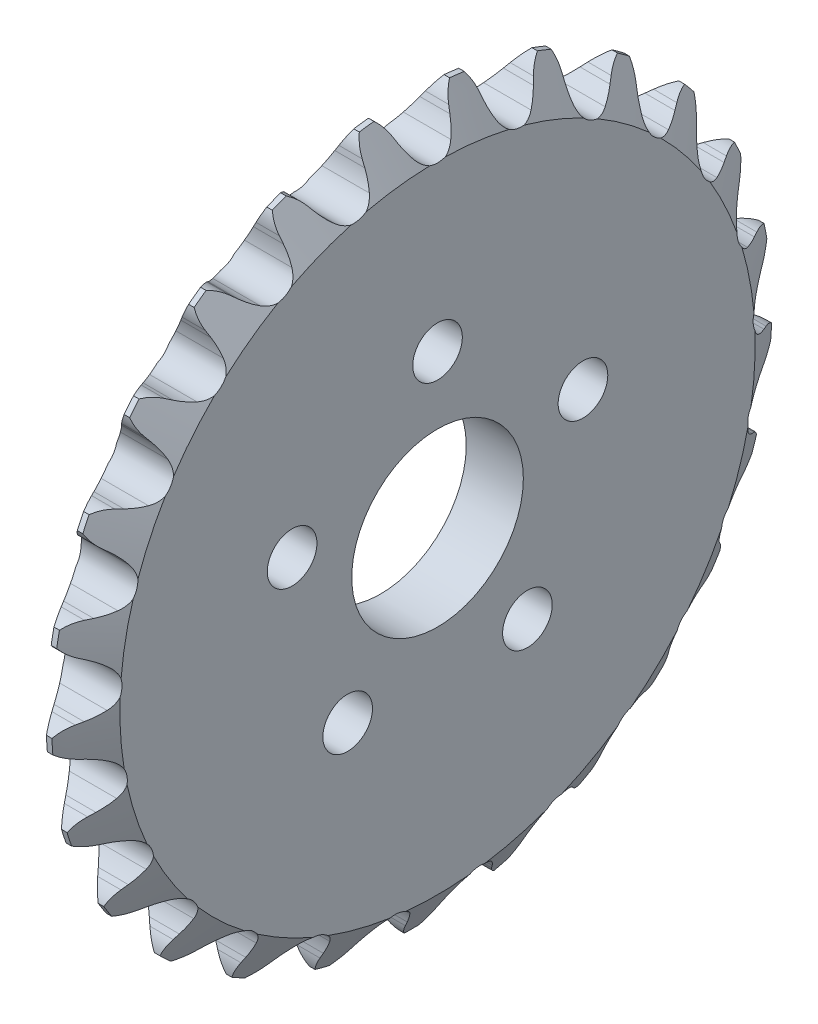
from build123d import *

# Parameters (mm, degrees)
CUT_EXTRUDE1_DEPTH = 39.130322484
CIRPATTERN1_COUNT  = 25
SKETCH4_R          = 6.4135
SKETCH4_R_2        = 1.8542
CUT_EXTRUDE2_DEPTH = 39.292119475


with BuildPart() as part:
    # Sketch2 → Revolve1 (revolve)
    with BuildSketch(Plane.XY):
        Polygon((-0.206375, 26.919966974), (0.206375, 26.919966974), (2.1336, 23.744966974), (2.1336, 0), (-2.1336, 0), (-2.1336, 23.744966974), align=None)
    revolve(axis=Axis((-2.1336, 0, 0), (1, 0, 0)))

    # Sketch3 → Cut-Extrude1 (cut, symmetric)
    with BuildSketch(Plane(origin=(0, 0, 0), x_dir=(0, 0, -1), z_dir=(1, 0, 0))):
        with BuildLine():
            Line((-2.095139452, 25.741428061), (-1.934616579, 25.336819069))
            ThreePointArc((-1.934616579, 25.336819069), (-1.677162492, 24.79898923), (-1.348403628, 24.301534555))
            ThreePointArc((-1.348403628, 24.301534555), (0, 23.635111974), (1.348403628, 24.301534555))
            ThreePointArc((1.348403628, 24.301534555), (1.677162492, 24.79898923), (1.934616579, 25.336819069))
            Line((1.934616579, 25.336819069), (2.095139452, 25.741428061))
            ThreePointArc((2.095139452, 25.741428061), (2.628519051, 26.58334), (3.432640864, 27.172150344))
            ThreePointArc((3.432640864, 27.172150344), (0, 27.388113802), (-3.432640864, 27.172150344))
            ThreePointArc((-3.432640864, 27.172150344), (-2.628519051, 26.58334), (-2.095139452, 25.741428061))
        make_face()
    cut_extrude1 = extrude(amount=CUT_EXTRUDE1_DEPTH, both=True, mode=Mode.SUBTRACT)

    # CirPattern1: Cut-Extrude1 ×25 about axis
    cirpattern1_axis = Axis((-88.99, 0, 0), (1, 0, 0))
    for i in range(1, CIRPATTERN1_COUNT):
        add(cut_extrude1.rotate(cirpattern1_axis, i * 360 / CIRPATTERN1_COUNT), mode=Mode.SUBTRACT)

    # Sketch4 → Cut-Extrude2 (cut, through all)
    with BuildSketch(Plane(origin=(2.1336, 0, 0), x_dir=(0, 0, -1), z_dir=(1, 0, 0))):
        Circle(SKETCH4_R)
        with Locations((0, 11.43)):
            Circle(SKETCH4_R_2)
        with Locations((10.870575981, 3.532064246)):
            Circle(SKETCH4_R_2)
        with Locations((6.718385434, -9.247064246)):
            Circle(SKETCH4_R_2)
        with Locations((-6.718385434, -9.247064246)):
            Circle(SKETCH4_R_2)
        with Locations((-10.870575981, 3.532064246)):
            Circle(SKETCH4_R_2)
    extrude(amount=-CUT_EXTRUDE2_DEPTH, mode=Mode.SUBTRACT)


solid = part.part
